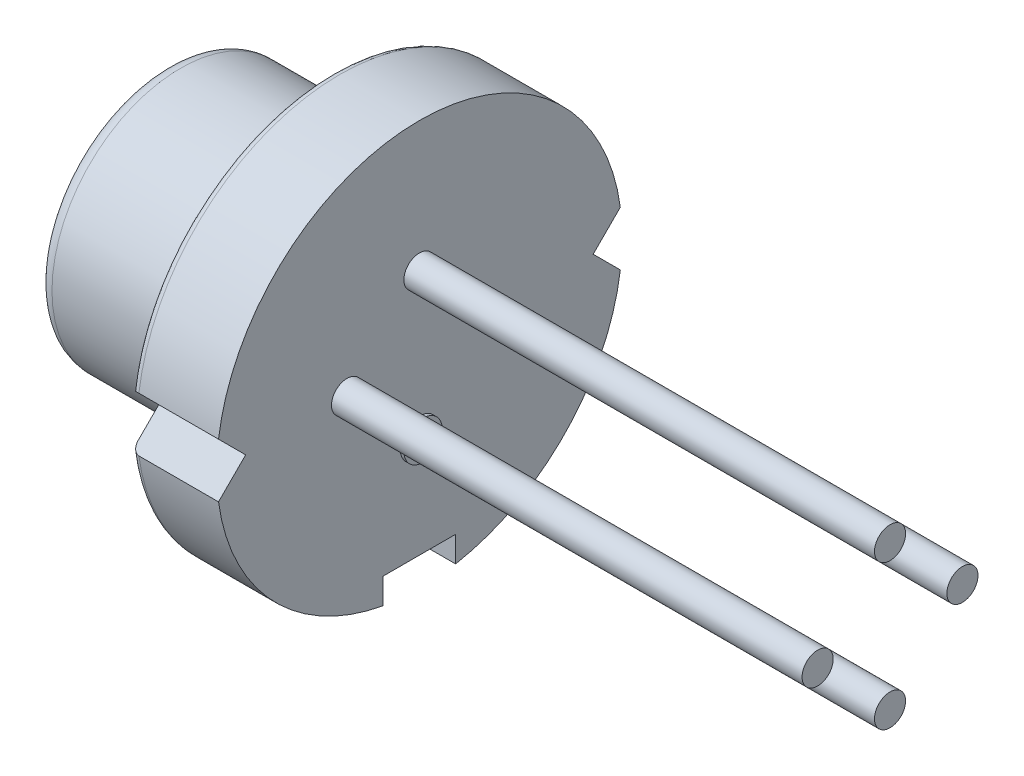
from build123d import *

# Parameters (mm, degrees)
SKETCH6_R           = 0.215
EXTRUDE2_DEPTH      = 6.5
CUT_EXTRUDE1_DEPTH  = 8.611175993
FILLET1_R           = 0.2
FILLET2_R           = 0.1
SKETCH6_3_R         = 0.265
SKETCH6_3_R_2       = 0.215
BOSS_EXTRUDE2_DEPTH = 0.05


with BuildPart() as part:
    # Sketch4 → Revolve2 (revolve)
    with BuildSketch(Plane.XY):
        with BuildLine():
            Line((0, 0), (0, 0.7))
            Line((0, 0.7), (-0.75, 0.7))
            Line((-0.75, 0.7), (-0.75, 0.8))
            Line((-0.75, 0.8), (-1, 0.8))
            Line((-1, 0.8), (-1, 1.775))
            Line((-1, 1.775), (0.75, 1.775))
            ThreePointArc((0.75, 1.775), (0.926776695, 1.848223305), (1, 2.025))
            Line((1, 2.025), (1, 2.1))
            Line((1, 2.1), (1.3, 2.1))
            Line((1.3, 2.1), (1.3, 2.8))
            Line((1.3, 2.8), (2.5, 2.8))
            Line((2.5, 2.8), (2.5, 0))
            Line((2.5, 0), (0, 0))
        make_face()
    revolve(axis=Axis((-2.49171246, 0, 0), (1, 0, 0)))

    # Sketch6 → Extrude2 (add)
    with BuildSketch(Plane(origin=(2.5, 0, 0), x_dir=(0, 0, -1), z_dir=(1, 0, 0))):
        with Locations((1, 0)):
            Circle(SKETCH6_R)
        with Locations((0, -1)):
            Circle(SKETCH6_R)
        with Locations((-1, 0)):
            Circle(SKETCH6_R)
        with Locations((0, 1)):
            Circle(SKETCH6_R)
    extrude(amount=EXTRUDE2_DEPTH)

    # Sketch8 → Cut-Extrude1 (cut, through all)
    with BuildSketch(Plane(origin=(2.5, 0, 0), x_dir=(0, 0, -1), z_dir=(1, 0, 0))):
        with BuildLine():
            Line((2.774801575, 0.374801575), (2.4, 0))
            Line((2.4, 0), (2.774801575, -0.374801575))
            ThreePointArc((2.774801575, -0.374801575), (2.8, 0), (2.774801575, 0.374801575))
        make_face()
        with BuildLine():
            Line((-2.4, 0), (-2.774801575, 0.374801575))
            ThreePointArc((-2.774801575, 0.374801575), (-2.8, 0), (-2.774801575, -0.374801575))
            Line((-2.774801575, -0.374801575), (-2.4, 0))
        make_face()
        with BuildLine():
            ThreePointArc((-0.5, -2.754995463), (0, -2.8), (0.5, -2.754995463))
            Line((0.5, -2.754995463), (0.5, -2.4))
            Line((0.5, -2.4), (-0.5, -2.4))
            Line((-0.5, -2.4), (-0.5, -2.754995463))
        make_face()
    extrude(amount=-CUT_EXTRUDE1_DEPTH, mode=Mode.SUBTRACT)

    # Fillet1
    fillet1_edges = [part.edges().sort_by_distance(p)[0] for p in [
        (-1, -1.775, 0),
    ]]
    fillet(fillet1_edges, radius=FILLET1_R)

    # Fillet2
    fillet2_edges = [part.edges().sort_by_distance(p)[0] for p in [
        (1.3, -1.934576937, -2.02420653),
        (1.3, -1.934576937, 2.02420653),
        (1.3, 2.8, 0),
    ]]
    fillet(fillet2_edges, radius=FILLET2_R)

    # Sketch6<3> → Boss-Extrude2 (add)
    with BuildSketch(Plane(origin=(2.5, 0, 0), x_dir=(0, 0, -1), z_dir=(1, 0, 0))):
        with Locations((0, -1)):
            Circle(SKETCH6_3_R)
        with Locations((0, -1)):
            Circle(SKETCH6_3_R_2, mode=Mode.SUBTRACT)
    extrude(amount=BOSS_EXTRUDE2_DEPTH)


solid = part.part
